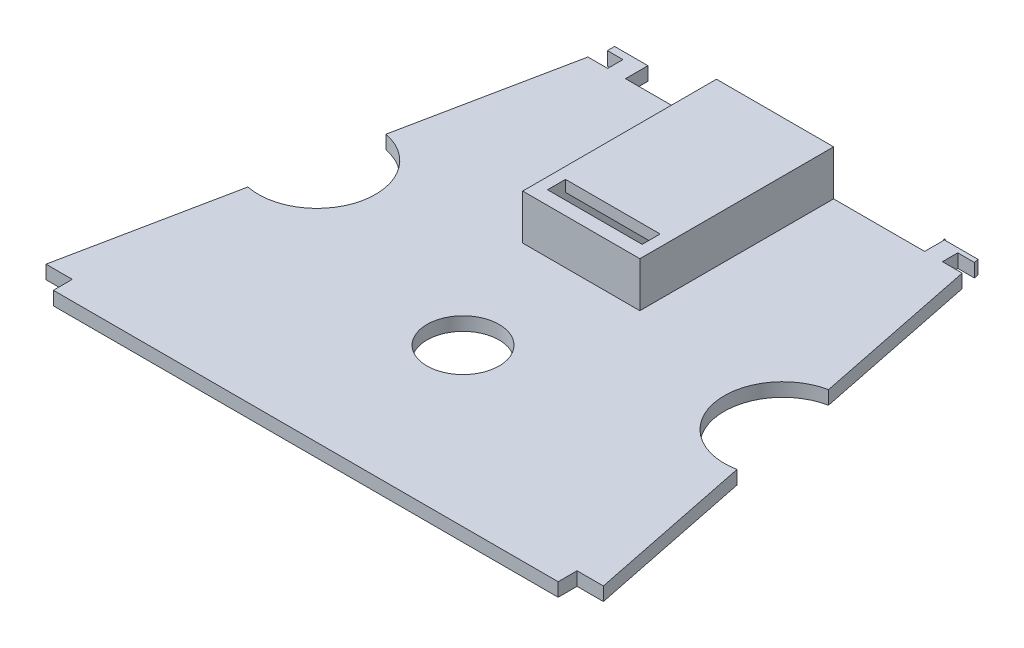
from build123d import *

# Parameters (mm, degrees)
SALIENTE_EXTRUIR2_DEPTH = 3
CROQUIS3_W              = 0.20141636
CROQUIS3_H              = 0.203887222
CROQUIS3_W_2            = 7.398041038
CROQUIS3_W_3            = 0.198837733
CROQUIS3_W_4            = 66
CROQUIS3_H_2            = 0.2
CORTAR_EXTRUIR1_DEPTH   = 83.783550537
CROQUIS4_R              = 13
CORTAR_EXTRUIR3_DEPTH   = 83.603212434
CROQUIS5_R              = 8
CORTAR_EXTRUIR4_DEPTH   = 83.603212434
CROQUIS6_W              = 26
CROQUIS6_H              = 26
CROQUIS6_W_2            = 21
CROQUIS6_H_2            = 21
SALIENTE_EXTRUIR5_DEPTH = 40
CROQUIS11_W             = 21
CROQUIS11_H             = 3
CORTAR_EXTRUIR7_DEPTH   = 40
CROQUIS12_W             = 26
CROQUIS12_H             = 26
SALIENTE_EXTRUIR6_DEPTH = 3
CROQUIS13_W             = 21
CROQUIS13_H             = 4
CORTAR_EXTRUIR8_DEPTH   = 3


# Read off the part's stored shape, not the designer's step: Saliente-Extruir2
with BuildPart() as part:
    # Saliente-Extruir2 outline → Saliente-Extruir2 (new body)
    with BuildSketch(Plane(origin=(0, 0, 0), x_dir=(1, 0, 0), z_dir=(0, 1, 0))):
        Polygon((41.692627312, 49.672839919), (37.346313656, 49.672839919), (37.346313656, 52.672839919), (41.08285537, 52.672839919), (40.798295131, 54.072839919), (33, 54.072839919), (33, 49.672839919), (-33, 49.672839919), (-33, 54.672839919), (-40.798295131, 54.672839919), (-40.798295131, 54.072839919), (-41.08285537, 52.672839919), (-37.346313656, 52.672839919), (-37.342667374, 49.672839919), (-41.692627312, 49.672839919), (-62.088620654, -50.672839919), (-56.210898261, -50.672839919), (-56.210898261, -54.672771312), (56.210898265, -54.672839919), (56.210898265, -50.672839919), (62.088620654, -50.672839919), align=None)
    extrude(amount=SALIENTE_EXTRUIR2_DEPTH)

    # Croquis3 → Cortar-Extruir1 (cut, through all)
    with BuildSketch(Plane(origin=(0, 3, 0), x_dir=(1, 0, 0), z_dir=(0, 1, 0))):
        Polygon((-41.533278775, 49.472839919), (-41.733278775, 49.472839919), (-62.047969191, -50.472839919), (-61.847969191, -50.472839919), align=None)
        Polygon((-61.847969191, -50.472839919), (-62.047969191, -50.472839919), (-62.088620654, -50.672839919), (-61.888620654, -50.672839919), align=None)
        Polygon((-56.010898261, -50.472839919), (-61.847969191, -50.472839919), (-61.888620654, -50.672839919), (-56.210898261, -50.672839919), (-56.210898261, -54.672771312), (-56.010898261, -54.672771434), (-56.010898261, -50.672839919), align=None)
        Polygon((-41.492627312, 49.672839919), (-41.692627312, 49.672839919), (-41.733278775, 49.472839919), (-41.533278775, 49.472839919), align=None)
        Polygon((-37.342667374, 49.672839919), (-41.492627312, 49.672839919), (-41.533278775, 49.472839919), (-37.342667374, 49.472839919), align=None)
        Polygon((-37.346313656, 52.672839919), (-37.342667374, 49.672839919), (-37.342667374, 49.472839919), (-37.147468141, 49.472839919), (-37.147468141, 52.868255538), (-40.596878771, 52.868255538), (-40.596878771, 52.672839919), align=None)
        Polygon((-41.08285537, 52.672839919), (-40.596878771, 52.672839919), (-40.596878771, 52.868255538), (-41.043135716, 52.868255538), align=None)
        Polygon((-41.043135716, 52.868255538), (-40.596878771, 52.868255538), (-40.596878771, 54.468952697), (-40.798295131, 54.468952697), (-40.798295131, 54.072839919), align=None)
        with Locations((-40.697586951, 54.570896308)):
            Rectangle(CROQUIS3_W, CROQUIS3_H)
        with Locations((-36.897858252, 54.570896308)):
            Rectangle(CROQUIS3_W_2, CROQUIS3_H)
        with Locations((-33.099418867, 54.570896308)):
            Rectangle(CROQUIS3_W_3, CROQUIS3_H)
        Polygon((-33, 54.468952697), (-33.198837733, 54.468952697), (-33.198837733, 49.472839919), (-33, 49.472839919), (-33, 49.672839919), align=None)
        with Locations((0, 49.572839919)):
            Rectangle(CROQUIS3_W_4, CROQUIS3_H_2)
        Polygon((33, 53.87402838), (33, 49.672839919), (33, 49.472839919), (33.198022075, 49.472839919), (33.198022075, 53.87402838), align=None)
        Polygon((37.147315766, 49.472839919), (37.346313656, 49.472839919), (37.346313656, 49.672839919), (37.346313656, 52.672839919), (37.346313656, 52.875922627), (37.147315766, 52.875922627), align=None)
        Polygon((40.881086684, 52.672839919), (40.840358146, 52.875922627), (37.346313656, 52.875922627), (37.346313656, 52.672839919), align=None)
        Polygon((33.198022075, 54.072839919), (33.198022075, 53.87402838), (40.640186558, 53.87402838), (40.60031461, 54.072839919), align=None)
        Polygon((40.83870503, 53.87402838), (40.640186558, 53.87402838), (40.840358146, 52.875922627), (41.041577324, 52.875922627), align=None)
        Polygon((41.041577324, 52.875922627), (40.840358146, 52.875922627), (40.881086684, 52.672839919), (41.08285537, 52.672839919), align=None)
        Polygon((40.60031461, 54.072839919), (40.640186558, 53.87402838), (40.83870503, 53.87402838), (40.798295131, 54.072839919), align=None)
        Polygon((37.346313656, 49.472839919), (41.533278775, 49.472839919), (41.492627312, 49.672839919), (37.346313656, 49.672839919), align=None)
        Polygon((41.492627312, 49.672839919), (41.533278775, 49.472839919), (41.733278775, 49.472839919), (41.692627312, 49.672839919), align=None)
        Polygon((41.533278775, 49.472839919), (61.847969191, -50.472839919), (62.047969191, -50.472839919), (41.733278775, 49.472839919), align=None)
        Polygon((56.210898265, -50.472839919), (56.210898265, -50.672839919), (61.888620654, -50.672839919), (61.847969191, -50.472839919), align=None)
        Polygon((61.847969191, -50.472839919), (61.888620654, -50.672839919), (62.088620654, -50.672839919), (62.047969191, -50.472839919), align=None)
        Polygon((56.010898265, -50.672839919), (56.010898265, -54.672839797), (56.210898265, -54.672839919), (56.210898265, -50.672839919), (56.210898265, -50.472839919), (56.010898265, -50.472839919), align=None)
    extrude(amount=-CORTAR_EXTRUIR1_DEPTH, mode=Mode.SUBTRACT)


with BuildPart() as cortar_extruir1_piece_1:
    # of the separate pieces the step leaves, piece 1, a body of its own (cortar_extruir1_pieces)
    add(part.part.solids().sort_by_distance((-56.010898261, 0, 54.672771434))[0])

    # Croquis4 → Cortar-Extruir3 (cut, through all)
    with BuildSketch(Plane(origin=(0, 3, 0), x_dir=(1, 0, 0), z_dir=(0, 1, 0))):
        with Locations((-51.690623983, -0.5)):
            Circle(CROQUIS4_R)
        with Locations((51.690623983, -0.5)):
            Circle(CROQUIS4_R)
    extrude(amount=-CORTAR_EXTRUIR3_DEPTH, mode=Mode.SUBTRACT)

    # Croquis5 → Cortar-Extruir4 (cut, through all)
    with BuildSketch(Plane(origin=(0, 3, 0), x_dir=(1, 0, 0), z_dir=(0, 1, 0))):
        with Locations(Location((0, -19.769203208, 0), (0, 0, 270))):
            Circle(CROQUIS5_R)
    extrude(amount=-CORTAR_EXTRUIR4_DEPTH, mode=Mode.SUBTRACT)

    # Croquis6 → Saliente-Extruir5 (add)
    with BuildSketch(Plane(origin=(0, 0, -49.472839919), x_dir=(-1, 0, 0), z_dir=(0, 0, -1))):
        Rectangle(CROQUIS6_W, CROQUIS6_H)
        Rectangle(CROQUIS6_W_2, CROQUIS6_H_2, mode=Mode.SUBTRACT)
    extrude(amount=-SALIENTE_EXTRUIR5_DEPTH)

    # Croquis11 → Cortar-Extruir7 (cut)
    with BuildSketch(Plane(origin=(0, 0, -49.472839919), x_dir=(-1, 0, 0), z_dir=(0, 0, -1))):
        with Locations((0, 1.5)):
            Rectangle(CROQUIS11_W, CROQUIS11_H)
    extrude(amount=-CORTAR_EXTRUIR7_DEPTH, mode=Mode.SUBTRACT)

    # Croquis12 → Saliente-Extruir6 (add)
    with BuildSketch(Plane.XY.offset(-9.472839919)):
        Rectangle(CROQUIS12_W, CROQUIS12_H)
    extrude(amount=SALIENTE_EXTRUIR6_DEPTH)

    # Croquis13 → Cortar-Extruir8 (cut)
    with BuildSketch(Plane(origin=(0, 13, 0), x_dir=(1, 0, 0), z_dir=(0, 1, 0))):
        with Locations((0, 11.472839919)):
            Rectangle(CROQUIS13_W, CROQUIS13_H)
    extrude(amount=-CORTAR_EXTRUIR8_DEPTH, mode=Mode.SUBTRACT)


with BuildPart() as cortar_extruir1_piece_2:
    # of the separate pieces the step leaves, piece 2, a body of its own (cortar_extruir1_pieces)
    add(part.part.solids().sort_by_distance((33.198022075, 0, -54.072839919))[0])


solid = Compound([cortar_extruir1_piece_1.part, cortar_extruir1_piece_2.part])
